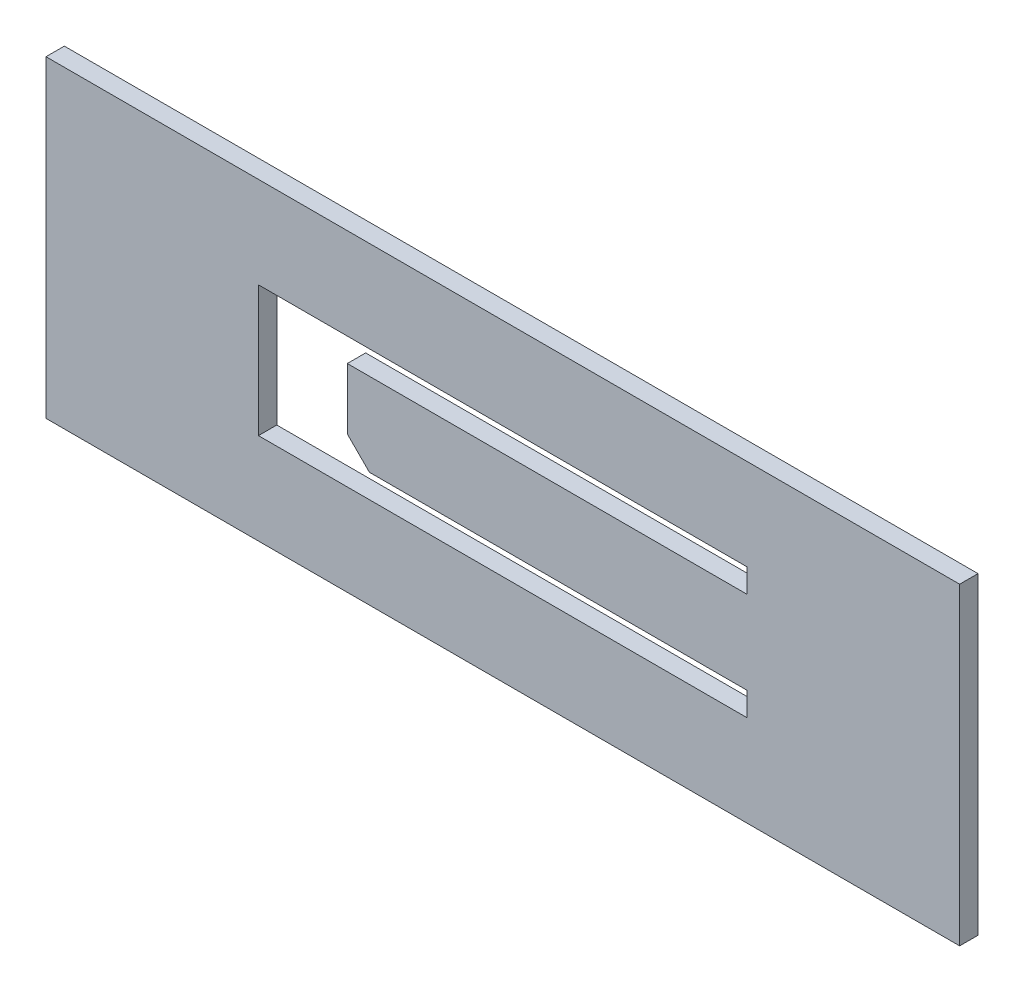
from build123d import *

# Parameters (mm, degrees)
F_1_FR_W               = 149.275698602
F_1_FR_H               = 51.18023952
SM_BASE_FLANGE_1_DEPTH = 3


# Sheet-metal steps are written as plain solids
with BuildPart() as part:
    # Эскиз1_fr → Базовая кромка1 (new body)
    with BuildSketch(Plane.XY):
        Rectangle(F_1_FR_W, F_1_FR_H)
        Polygon((39.926451229, -10.672105555), (-39.926451229, -10.672105555), (-39.926451229, 10.672105555), (39.926451229, 10.672105555), (39.926451229, 6.791965083), (-25.410080628, 6.791965083), (-25.410080628, -3.177311756), (-21.795427302, -6.791965083), (39.926451229, -6.791965083), align=None, mode=Mode.SUBTRACT)
    extrude(amount=-SM_BASE_FLANGE_1_DEPTH)


solid = part.part
